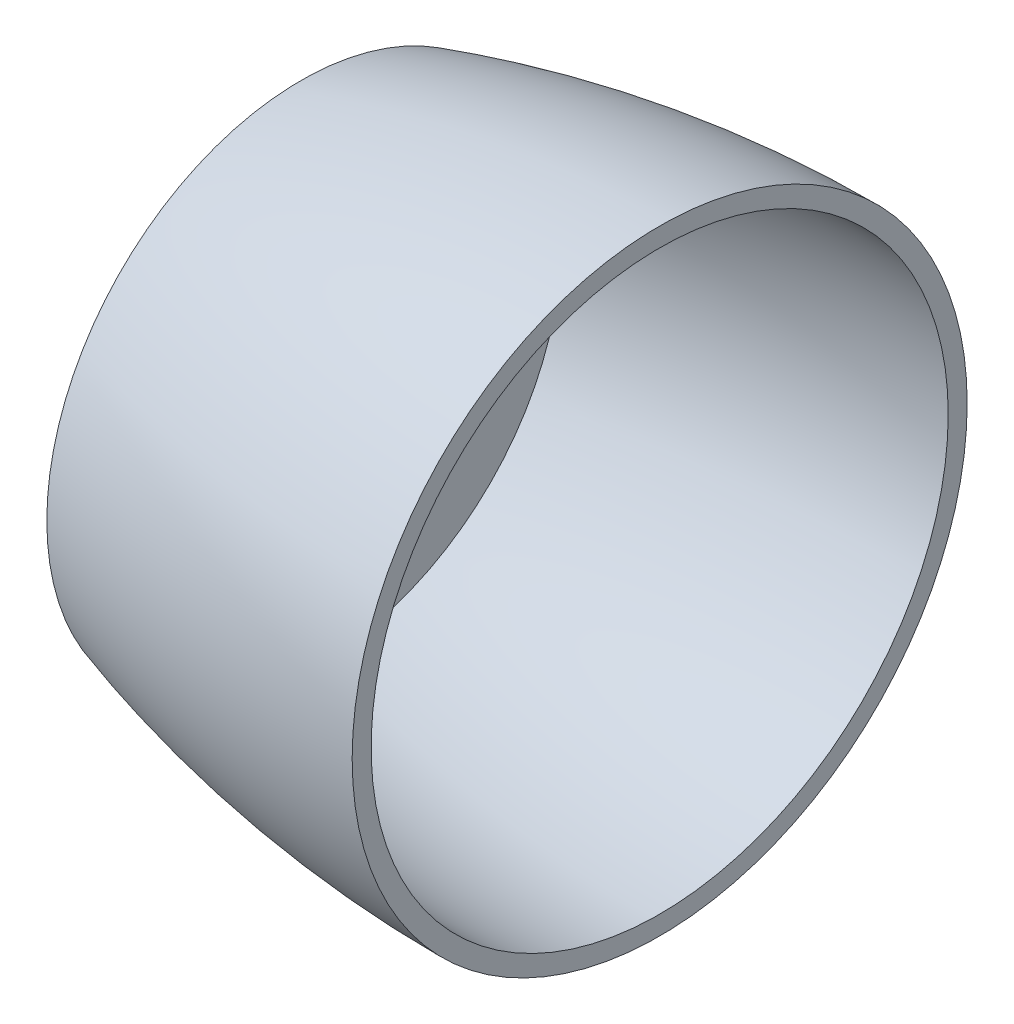
from build123d import *

# Parameters (mm, degrees)
CUT_EXTRUDE1_REACH = 31.73
SKETCH2_R          = 1.25


# Read off the part's stored shape, not the designer's step: Roller coating 12, Roller core 12 coated
with BuildPart() as part:
    # Roller coating 12 outline → Roller coating 12 (revolve)
    with BuildSketch(Plane.YX):
        with BuildLine():
            ThreePointArc((12.7, -17.916428128), (15.217989764, 0), (12.7, 17.916428128))
            Line((12.7, 17.916428128), (8, 17.916428128))
            Line((8, 17.916428128), (8, 17.416428128))
            Line((8, 17.416428128), (12.322080058, 17.416428128))
            ThreePointArc((12.322080058, 17.416428128), (14.717989764, 0), (12.322080058, -17.416428128))
            Line((12.322080058, -17.416428128), (8, -17.416428128))
            Line((8, -17.416428128), (8, -17.916428128))
            Line((8, -17.916428128), (12.7, -17.916428128))
        make_face()
    revolve(axis=Axis((0, 0, 0), (1, 0, 0)))


with BuildPart() as body_2:
    # Roller core 12 coated outline → Roller core 12 coated (revolve)
    with BuildSketch(Plane.YX):
        with BuildLine():
            Line((1.25, 17.416428128), (1.25, -17.416428128))
            Line((1.25, -17.416428128), (12.322080058, -17.416428128))
            ThreePointArc((12.322080058, -17.416428128), (14.717989764, 0), (12.322080058, 17.416428128))
            Line((12.322080058, 17.416428128), (1.25, 17.416428128))
        make_face()
    revolve(axis=Axis((0, 0, 0), (1, 0, 0)))


with BuildPart() as body_3:
    # Sketch1 → Revolve1 (revolve)
    with BuildSketch(Plane.XY, mode=Mode.PRIVATE) as revolve1_sk:
        with BuildLine():
            Line((0, 0), (-17.916428128, 0))
            Line((-17.916428128, 0), (-18.916428128, 0))
            Line((-18.916428128, 0), (-18.916428128, 13.404553802))
            ThreePointArc((-18.916428128, 13.404553802), (-9.562252285, 15.510783538), (0, 16.217989764))
            Line((0, 16.217989764), (0, 15.217989764))
            Line((0, 15.217989764), (0, 0))
        make_face()
    revolve(revolve1_sk.sketch.rotate(Axis((0, 0, 0), (-1, 0, 0)), 90), axis=Axis((0, 0, 0), (-1, 0, 0)))

    # Combine1: cut body 2
    add(body_2.part, mode=Mode.SUBTRACT)

    # Combine2: cut part
    add(part.part, mode=Mode.SUBTRACT)

    # Sketch2 → Cut-Extrude1 (cut, up to next)
    with BuildSketch(Plane(origin=(0, 0, 0), x_dir=(0, 0, -1), z_dir=(1, 0, 0)), mode=Mode.PRIVATE) as cut_extrude1_sk1:
        with Locations(Location((0, 0, 0), (0, 0, 180))):
            Circle(SKETCH2_R)
    cut_extrude1_tool1 = extrude(cut_extrude1_sk1.sketch, amount=-CUT_EXTRUDE1_REACH, mode=Mode.PRIVATE) & body_3.part
    add(cut_extrude1_tool1.solids().sort_by_distance((0, 0, 0))[0], mode=Mode.SUBTRACT)


solid = body_3.part
